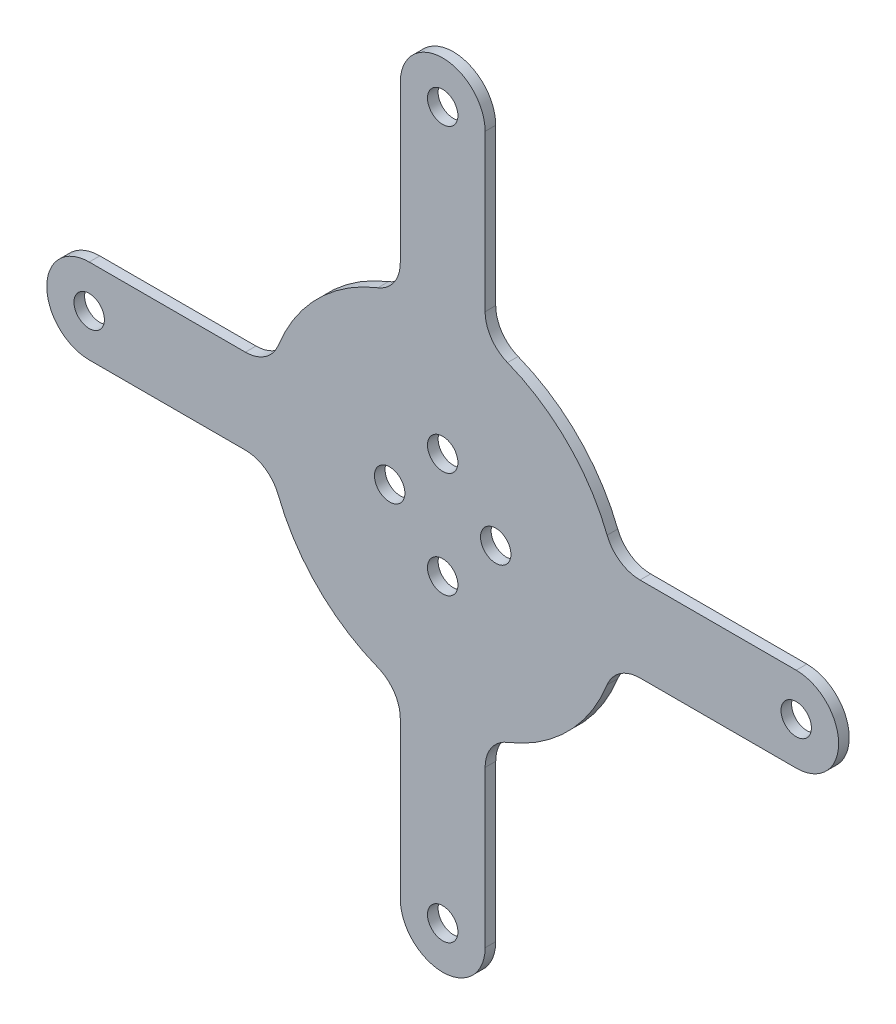
from build123d import *

# Parameters (mm, degrees)
SKETCH_1_R      = 2.15
EXTRUDE_1_DEPTH = 1.5
FILLET_1_R      = 5


with BuildPart() as part:
    # ｽｹｯﾁ1 → ﾎﾞｽ - 押し出し1 (new body)
    with BuildSketch(Plane.XY):
        with BuildLine():
            Line((-6, 50), (-6, 24.269322199))
            ThreePointArc((-6, 24.269322199), (-17.67766953, 17.67766953), (-24.269322199, 6))
            Line((-24.269322199, 6), (-50, 6))
            ThreePointArc((-50, 6), (-56, 0), (-50, -6))
            Line((-50, -6), (-24.269322199, -6))
            ThreePointArc((-24.269322199, -6), (-17.67766953, -17.67766953), (-6, -24.269322199))
            Line((-6, -24.269322199), (-6, -50))
            ThreePointArc((-6, -50), (0, -56), (6, -50))
            Line((6, -50), (6, -24.269322199))
            ThreePointArc((6, -24.269322199), (17.67766953, -17.67766953), (24.269322199, -6))
            Line((24.269322199, -6), (50, -6))
            ThreePointArc((50, -6), (56, 0), (50, 6))
            Line((50, 6), (24.269322199, 6))
            ThreePointArc((24.269322199, 6), (17.67766953, 17.67766953), (6, 24.269322199))
            Line((6, 24.269322199), (6, 50))
            ThreePointArc((6, 50), (0, 56), (-6, 50))
        make_face()
        with Locations((0, 7.5)):
            Circle(SKETCH_1_R, mode=Mode.SUBTRACT)
        with Locations((0, 50)):
            Circle(SKETCH_1_R, mode=Mode.SUBTRACT)
        with Locations((50, 0)):
            Circle(SKETCH_1_R, mode=Mode.SUBTRACT)
        with Locations((7.5, 0)):
            Circle(SKETCH_1_R, mode=Mode.SUBTRACT)
        with Locations((0, -50)):
            Circle(SKETCH_1_R, mode=Mode.SUBTRACT)
        with Locations((0, -7.5)):
            Circle(SKETCH_1_R, mode=Mode.SUBTRACT)
        with Locations((-50, 0)):
            Circle(SKETCH_1_R, mode=Mode.SUBTRACT)
        with Locations((-7.5, 0)):
            Circle(SKETCH_1_R, mode=Mode.SUBTRACT)
    extrude(amount=EXTRUDE_1_DEPTH)

    # ﾌｨﾚｯﾄ1
    fillet_1_edges = [part.edges().sort_by_distance(p)[0] for p in [
        (-6, 24.269322199, 0.75),
        (-24.269322199, 6, 0.75),
        (-24.269322199, -6, 0.75),
        (-6, -24.269322199, 0.75),
        (6, -24.269322199, 0.75),
        (24.269322199, -6, 0.75),
        (24.269322199, 6, 0.75),
        (6, 24.269322199, 0.75),
    ]]
    fillet(fillet_1_edges, radius=FILLET_1_R)


solid = part.part
